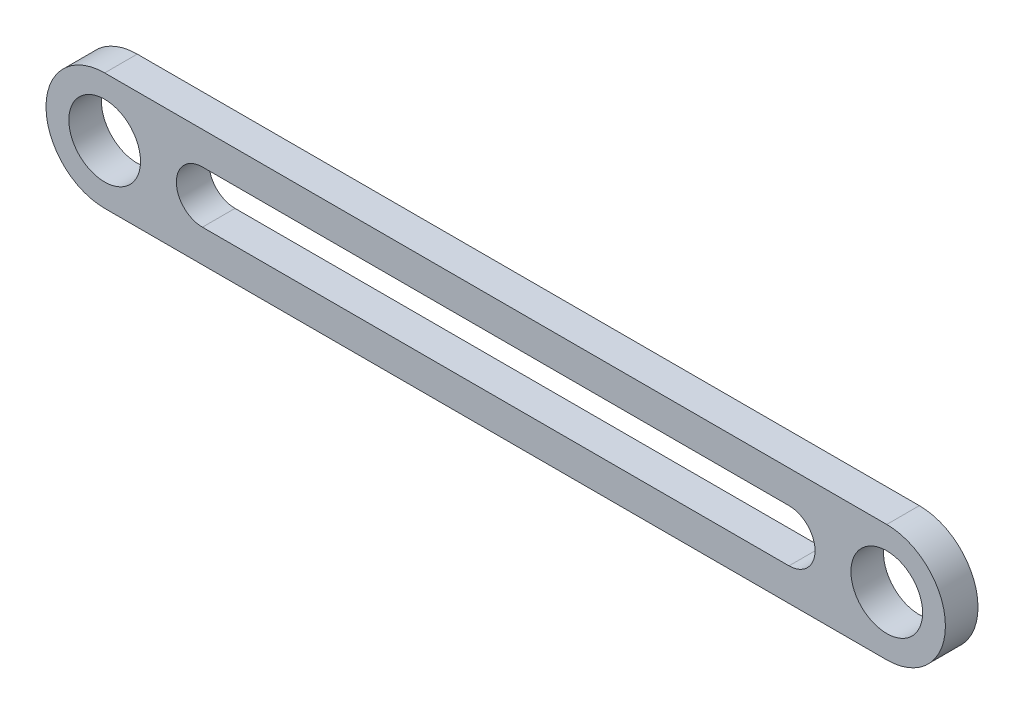
from build123d import *

# Parameters (mm, degrees)
SKETCH1_R           = 5.5
BOSS_EXTRUDE1_DEPTH = 5
CUT_EXTRUDE1_DEPTH  = 10


with BuildPart() as part:
    # Sketch1 → Boss-Extrude1 (new body)
    with BuildSketch(Plane.XY):
        with BuildLine():
            Line((-60, 9), (60, 9))
            ThreePointArc((60, 9), (69, 0), (60, -9))
            Line((60, -9), (-60, -9))
            ThreePointArc((-60, -9), (-69, 0), (-60, 9))
        make_face()
        with Locations((-60, 0)):
            Circle(SKETCH1_R, mode=Mode.SUBTRACT)
        with Locations((60, 0)):
            Circle(SKETCH1_R, mode=Mode.SUBTRACT)
    extrude(amount=BOSS_EXTRUDE1_DEPTH)

    # Sketch2 → Cut-Extrude1 (cut)
    with BuildSketch(Plane.XY.offset(5)):
        with BuildLine():
            Line((-45, 4), (45, 4))
            ThreePointArc((45, 4), (49, 0), (45, -4))
            Line((45, -4), (-45, -4))
            ThreePointArc((-45, -4), (-49, 0), (-45, 4))
        make_face()
    extrude(amount=-CUT_EXTRUDE1_DEPTH, mode=Mode.SUBTRACT)


solid = part.part
